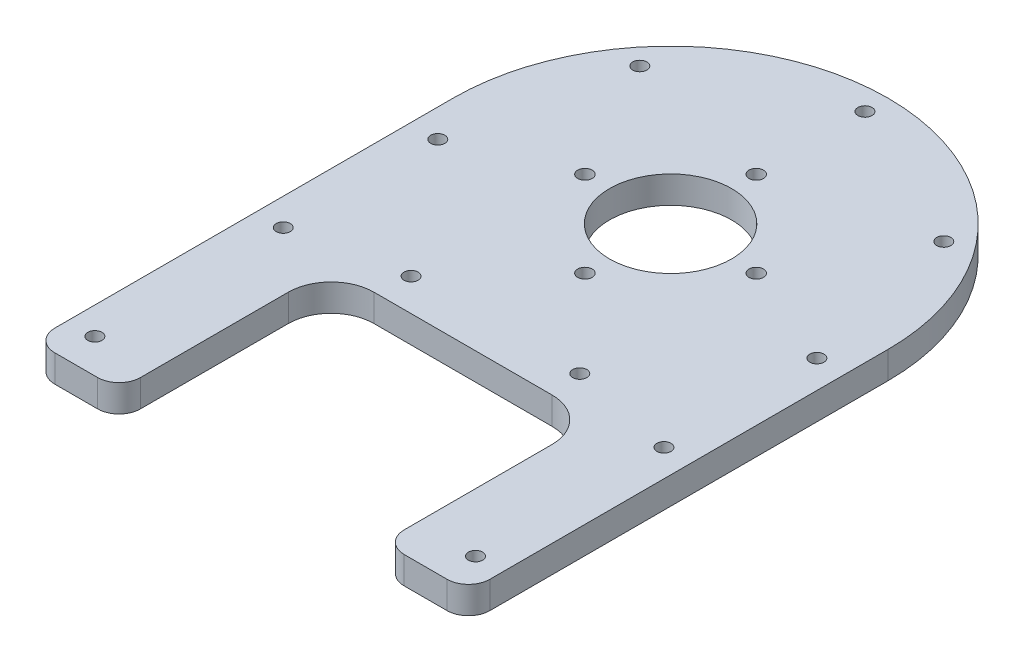
from build123d import *

# Parameters (mm, degrees)
BOSS_EXTRUDE1_DEPTH          = 6.35
FILLET1_R                    = 10
M4X0_7_TAPPED_HOLE1_D        = 3.3
M4X0_7_TAPPED_HOLE2_D        = 3.3
FILLET2_R                    = 5
CUT_EXTRUDE1_DEPTH           = 111.566552356
CUT_EXTRUDE1_DEPTH_BACK      = 111.566552356
SKETCH10_R                   = 14.25
M3_CLEARANCE_HOLE1_OUTLINE_R = 1.7
M3_CLEARANCE_HOLE1_DEPTH     = 6.35


# Read off the part's stored shape, not the designer's step: M3 Clearance Hole1
with BuildPart() as part:
    # Sketch2 → Boss-Extrude1 (new body)
    with BuildSketch(Plane(origin=(0, 0, 0), x_dir=(1, 0, 0), z_dir=(0, 1, 0))):
        with BuildLine():
            Line((-36.071416662, -35.77), (-50.8, -35.77))
            Line((-50.8, -35.77), (-50.8, -98))
            Line((-50.8, -98), (-30.8, -98))
            Line((-30.8, -98), (-30.8, -48.47))
            Line((-30.8, -48.47), (-15.208520638, -48.47))
            ThreePointArc((-15.208520638, -48.47), (-26.414588628, -43.392505201), (-36.071416662, -35.77))
        make_face()
        with BuildLine():
            Line((0, -35.77), (-36.071416662, -35.77))
            ThreePointArc((-36.071416662, -35.77), (-26.414588628, -43.392505201), (-15.208520638, -48.47))
            Line((-15.208520638, -48.47), (0, -48.47))
            Line((0, -48.47), (0, -35.77))
        make_face()
        with BuildLine():
            Line((36.071416662, -35.77), (0, -35.77))
            Line((0, -35.77), (0, -48.47))
            Line((0, -48.47), (15.208520638, -48.47))
            ThreePointArc((15.208520638, -48.47), (26.414588628, -43.392505201), (36.071416662, -35.77))
        make_face()
        with BuildLine():
            Line((50.8, -98), (50.8, -35.77))
            Line((50.8, -35.77), (36.071416662, -35.77))
            ThreePointArc((36.071416662, -35.77), (26.414588628, -43.392505201), (15.208520638, -48.47))
            Line((15.208520638, -48.47), (30.8, -48.47))
            Line((30.8, -48.47), (30.8, -98))
            Line((30.8, -98), (50.8, -98))
        make_face()
        with BuildLine():
            Line((50.8, -35.77), (50.8, 0))
            ThreePointArc((50.8, 0), (46.973758453, -19.34182041), (36.071416662, -35.77))
            Line((36.071416662, -35.77), (50.8, -35.77))
        make_face()
        with BuildLine():
            Line((50.8, 0), (0, 0))
            Line((0, 0), (0, -35.77))
            Line((0, -35.77), (36.071416662, -35.77))
            ThreePointArc((36.071416662, -35.77), (46.973758453, -19.34182041), (50.8, 0))
        make_face()
        with BuildLine():
            ThreePointArc((50.8, 0), (0, 50.8), (-50.8, 0))
            Line((-50.8, 0), (0, 0))
            Line((0, 0), (50.8, 0))
        make_face()
        with BuildLine():
            Line((0, 0), (-50.8, 0))
            ThreePointArc((-50.8, 0), (-46.973758453, -19.34182041), (-36.071416662, -35.77))
            Line((-36.071416662, -35.77), (0, -35.77))
            Line((0, -35.77), (0, 0))
        make_face()
        with BuildLine():
            ThreePointArc((-36.071416662, -35.77), (-46.973758453, -19.34182041), (-50.8, 0))
            Line((-50.8, 0), (-50.8, -35.77))
            Line((-50.8, -35.77), (-36.071416662, -35.77))
        make_face()
    extrude(amount=BOSS_EXTRUDE1_DEPTH)

    # Fillet1
    fillet1_edges = [part.edges().sort_by_distance(p)[0] for p in [
        (30.8, 3.175, 48.47),
        (-30.8, 3.175, 48.47),
    ]]
    fillet(fillet1_edges, radius=FILLET1_R)

    # M4x0.7 Tapped Hole1 (through all)
    with Locations(Plane(origin=(0, 6.35, 0), x_dir=(1, 0, 0), z_dir=(0, 1, 0))):
        with Locations((-44.45, -46), (-44.45, -90), (44.45, -90), (44.45, -46)):
            Hole(M4X0_7_TAPPED_HOLE1_D / 2)

    # M4x0.7 Tapped Hole2 (through all)
    with Locations(Plane(origin=(0, 6.35, 0), x_dir=(1, 0, 0), z_dir=(0, 1, 0))):
        with Locations((-19.698321756, -40.903986603), (19.698321756, -40.903986603), (-44.261727213, -10.102450402), (-35.495149304, 28.306437004), (0, 45.4), (35.495149304, 28.306437004), (44.261727213, -10.102450402)):
            Hole(M4X0_7_TAPPED_HOLE2_D / 2)

    # Fillet2
    fillet2_edges = [part.edges().sort_by_distance(p)[0] for p in [
        (50.8, 3.175, 98),
        (30.8, 3.175, 98),
        (-30.8, 3.175, 98),
        (-50.8, 3.175, 98),
    ]]
    fillet(fillet2_edges, radius=FILLET2_R)

    # Sketch10 → Cut-Extrude1 (cut, two sides: drawn at the far end of the back side and taken through both)
    with BuildSketch(Plane(origin=(0, 6.35, 0), x_dir=(1, 0, 0), z_dir=(0, 1, 0)).offset(-CUT_EXTRUDE1_DEPTH_BACK)):
        with Locations(Location((0, 0, 0), (0, 0, 270))):
            Circle(SKETCH10_R)
    extrude(amount=CUT_EXTRUDE1_DEPTH + CUT_EXTRUDE1_DEPTH_BACK, mode=Mode.SUBTRACT)

    # M3 Clearance Hole1 outline → M3 Clearance Hole1 (cut)
    with BuildSketch(Plane(origin=(0, 0, 0), x_dir=(1, 0, 0), z_dir=(0, 1, 0))):
        with Locations((-20, 0)):
            Circle(M3_CLEARANCE_HOLE1_OUTLINE_R)
        with Locations((20, 0)):
            Circle(M3_CLEARANCE_HOLE1_OUTLINE_R)
        with Locations((0, 20)):
            Circle(M3_CLEARANCE_HOLE1_OUTLINE_R)
        with Locations((0, -20)):
            Circle(M3_CLEARANCE_HOLE1_OUTLINE_R)
    extrude(amount=M3_CLEARANCE_HOLE1_DEPTH, mode=Mode.SUBTRACT)


solid = part.part
